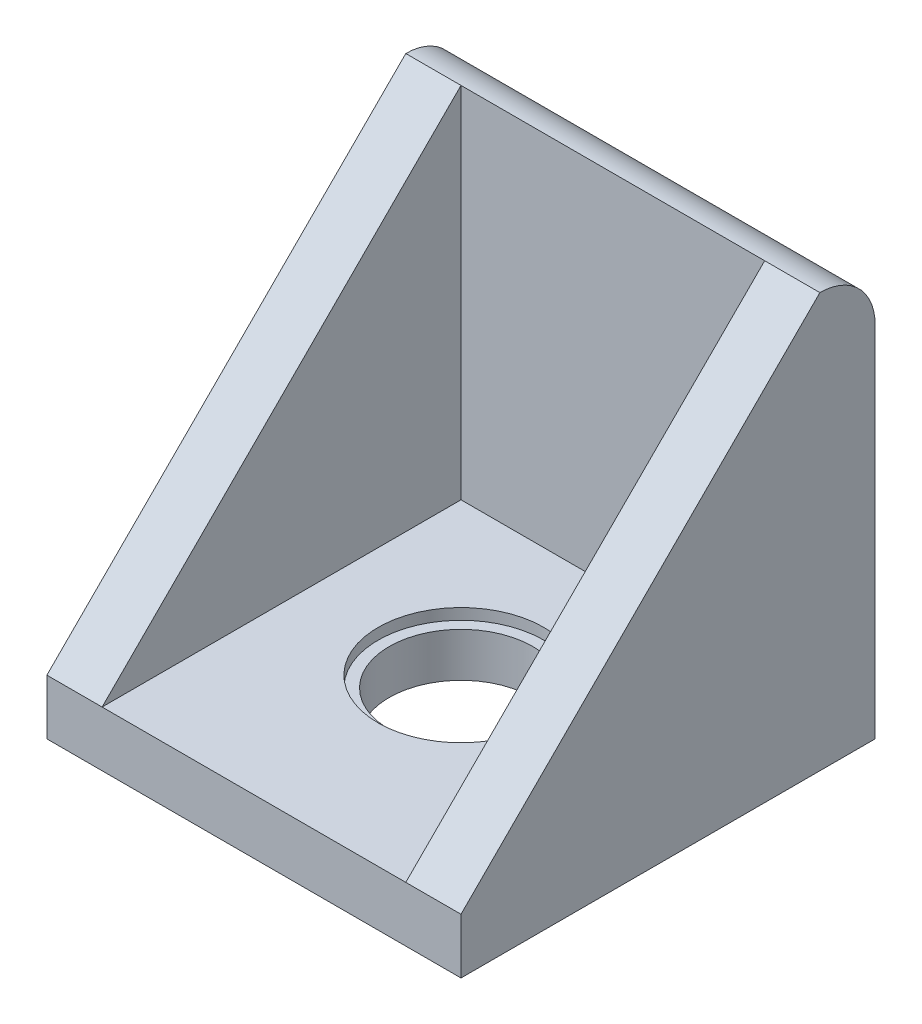
from build123d import *

# Parameters (mm, degrees)
SKETCH1_W           = 7.5
SKETCH1_H           = 7.5
BOSS_EXTRUDE1_DEPTH = 7.5
SKETCH2_W           = 5.5
SKETCH2_H           = 6.5
CUT_EXTRUDE1_DEPTH  = 6.5
CUT_EXTRUDE2_REACH  = 13.25
SKETCH4_R           = 1.3
CUT_EXTRUDE3_DEPTH  = 1
SKETCH5_R           = 1.5
CUT_EXTRUDE4_DEPTH  = 0.2
FILLET1_R           = 1


with BuildPart() as part:
    # Sketch1 → Boss-Extrude1 (new body)
    with BuildSketch(Plane(origin=(0, 0, 0), x_dir=(1, 0, 0), z_dir=(0, 1, 0))):
        Rectangle(SKETCH1_W, SKETCH1_H)
    extrude(amount=BOSS_EXTRUDE1_DEPTH)

    # Sketch2 → Cut-Extrude1 (cut)
    with BuildSketch(Plane(origin=(0, 7.5, 0), x_dir=(1, 0, 0), z_dir=(0, 1, 0))):
        with Locations((0, -0.5)):
            Rectangle(SKETCH2_W, SKETCH2_H)
    extrude(amount=-CUT_EXTRUDE1_DEPTH, mode=Mode.SUBTRACT)

    # Cut-Extrude2: up to this face of the body (flat: up to its plane)
    cut_extrude2_end = Plane(part.part.faces().sort_by_distance((-3.75, 3.75, 0))[0])
    # Sketch3 → Cut-Extrude2 (cut, up to the picked face)
    with BuildSketch(Plane(origin=(3.75, 0, 0), x_dir=(0, 0, -1), z_dir=(1, 0, 0)), mode=Mode.PRIVATE) as cut_extrude2_sk1:
        Polygon((-3.75, 7.5), (2.75, 7.5), (-3.75, 1), align=None)
    cut_extrude2_tool1 = split(extrude(cut_extrude2_sk1.sketch, amount=-CUT_EXTRUDE2_REACH, mode=Mode.PRIVATE), bisect_by=cut_extrude2_end, keep=Keep.BOTH, mode=Mode.PRIVATE)
    add(cut_extrude2_tool1.solids().sort_by(Axis((3.75, 5.333333, 1.583333), (-1, 0, 0)))[0], mode=Mode.SUBTRACT)

    # Sketch4 → Cut-Extrude3 (cut)
    with BuildSketch(Plane.XZ):
        with Locations(Location((0, 0, 0), (0, 0, 270))):
            Circle(SKETCH4_R)
    extrude(amount=-CUT_EXTRUDE3_DEPTH, mode=Mode.SUBTRACT)

    # Sketch5 → Cut-Extrude4 (cut)
    with BuildSketch(Plane(origin=(0, 1, 0), x_dir=(1, 0, 0), z_dir=(0, 1, 0))):
        with Locations(Location((0, 0, 0), (0, 0, 270))):
            Circle(SKETCH5_R)
    extrude(amount=-CUT_EXTRUDE4_DEPTH, mode=Mode.SUBTRACT)

    # Fillet1
    fillet1_edges = [part.edges().sort_by_distance(p)[0] for p in [
        (0, 7.5, -3.75),
    ]]
    fillet(fillet1_edges, radius=FILLET1_R - 0.0001)  # a hair under: the kernel refuses the full size


solid = part.part
